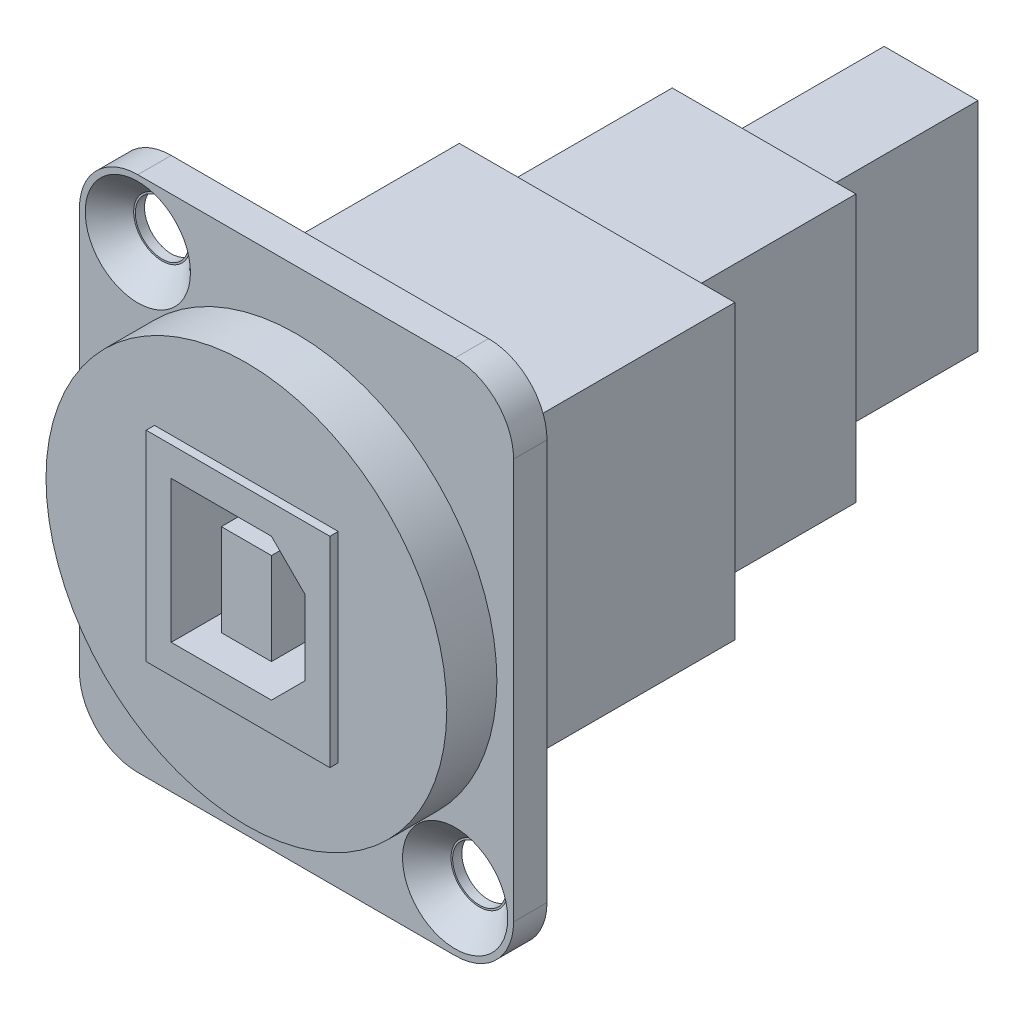
from build123d import *

# Parameters (mm, degrees)
SZKIC2_R                    = 12
DODANIE_WYCI_GNI_CIE1_DEPTH = 3
SZKIC2_3_W                  = 26
SZKIC2_3_H                  = 31
DODANIE_WYCI_GNI_CIE2_DEPTH = 2
DODANIE_WYCI_GNI_CIE3_START = -2
SZKIC2_4_W                  = 16.5
SZKIC2_4_H                  = 17.5
DODANIE_WYCI_GNI_CIE3_DEPTH = 16
DODANIE_WYCI_GNI_CIE4_START = -2
SZKIC2_5_W                  = 11
SZKIC2_5_H                  = 16
DODANIE_WYCI_GNI_CIE4_DEPTH = 26
ZAOKR_GLENIE1_R             = 3.5
SZKIC6_W                    = 5.62
SZKIC6_H                    = 13
SZKIC6_W_2                  = 5.12
SZKIC6_H_2                  = 12.5
SZKIC6_W_3                  = 2
SZKIC6_H_3                  = 11
DODANIE_WYCI_GNI_CIE5_DEPTH = 10
SZKIC7_W                    = 3
SZKIC7_H                    = 5.5
WYTNIJ_WYCI_GNI_CIE1_DEPTH  = 10
SZKIC7_3_W                  = 11
SZKIC7_3_H                  = 12
DODANIE_WYCI_GNI_CIE6_DEPTH = 0.5


# Read off the part's stored shape, not the designer's step: ZaawansowanyOtwór1
with BuildPart() as part:
    # Szkic2 → Dodanie-wyciągnięcie1 (new body)
    with BuildSketch(Plane.XY):
        Circle(SZKIC2_R)
    extrude(amount=DODANIE_WYCI_GNI_CIE1_DEPTH)

    # Szkic2<3> → Dodanie-wyciągnięcie2 (add)
    with BuildSketch(Plane.XY):
        Rectangle(SZKIC2_3_W, SZKIC2_3_H)
    extrude(amount=-DODANIE_WYCI_GNI_CIE2_DEPTH)

    # Szkic2<4> → Dodanie-wyciągnięcie3 (add)
    with BuildSketch(Plane.XY.offset(DODANIE_WYCI_GNI_CIE3_START)):
        Rectangle(SZKIC2_4_W, SZKIC2_4_H)
    extrude(amount=-DODANIE_WYCI_GNI_CIE3_DEPTH)

    # Szkic2<5> → Dodanie-wyciągnięcie4 (add)
    with BuildSketch(Plane.XY.offset(DODANIE_WYCI_GNI_CIE4_START)):
        Rectangle(SZKIC2_5_W, SZKIC2_5_H)
    extrude(amount=-DODANIE_WYCI_GNI_CIE4_DEPTH)

    # Zaokrąglenie1
    zaokr_glenie1_edges = [part.edges().sort_by_distance(p)[0] for p in [
        (-13, -15.5, -1),
        (-13, 15.5, -1),
        (13, 15.5, -1),
        (13, -15.5, -1),
    ]]
    fillet(zaokr_glenie1_edges, radius=ZAOKR_GLENIE1_R)

    # ZaawansowanyOtwór1 outline → ZaawansowanyOtwór1 (revolve, cut)
    with BuildSketch(Plane(origin=(9.5, -12, 0), x_dir=(1, 0, 0), z_dir=(0, -1, 0))):
        Polygon((1.6, -1.45), (1.7, -1.45), (3.15, 0), (0, 0), (0, -2), (1.6, -2), align=None)
    revolve(axis=Axis((9.5, -12, 0), (0, 0, 1)), mode=Mode.SUBTRACT)

    # ZaawansowanyOtw_r1 2 outline → ZaawansowanyOtw_r1 2 (revolve, cut)
    with BuildSketch(Plane(origin=(-9.5, 12, 0), x_dir=(1, 0, 0), z_dir=(0, -1, 0))):
        Polygon((3.15, 0), (0, 0), (0, -2), (1.6, -2), (1.6, -1.45), (1.7, -1.45), align=None)
    revolve(axis=Axis((-9.5, 12, 0), (0, 0, 1)), mode=Mode.SUBTRACT)

    # Szkic6 → Dodanie-wyciągnięcie5 (add)
    # profile 1 of 2: a face of its own
    with BuildSketch(Plane(origin=(0, 0, -28), x_dir=(-1, 0, 0), z_dir=(0, 0, -1))):
        Rectangle(SZKIC6_W, SZKIC6_H)
        Rectangle(SZKIC6_W_2, SZKIC6_H_2, mode=Mode.SUBTRACT)
    # profile 2 of 2: a face of its own
    with BuildSketch(Plane(origin=(0, 0, -28), x_dir=(-1, 0, 0), z_dir=(0, 0, -1))):
        with Locations((0.86, 0)):
            Rectangle(SZKIC6_W_3, SZKIC6_H_3)
    extrude(amount=DODANIE_WYCI_GNI_CIE5_DEPTH)

    # Szkic7 → Wytnij-wyciągnięcie1 (cut)
    with BuildSketch(Plane.XY.offset(3)):
        Polygon((-4, -4.25), (2, -4.25), (4, -2.25), (4, 2.25), (2, 4.25), (-4, 4.25), align=None)
        Rectangle(SZKIC7_W, SZKIC7_H, mode=Mode.SUBTRACT)
    extrude(amount=-WYTNIJ_WYCI_GNI_CIE1_DEPTH, mode=Mode.SUBTRACT)

    # Szkic7<3> → Dodanie-wyciągnięcie6 (add)
    with BuildSketch(Plane.XY.offset(3)):
        Rectangle(SZKIC7_3_W, SZKIC7_3_H)
        Polygon((2, -4.25), (4, -2.25), (4, 2.25), (2, 4.25), (-4, 4.25), (-4, -4.25), align=None, mode=Mode.SUBTRACT)
    extrude(amount=DODANIE_WYCI_GNI_CIE6_DEPTH)


solid = part.part
